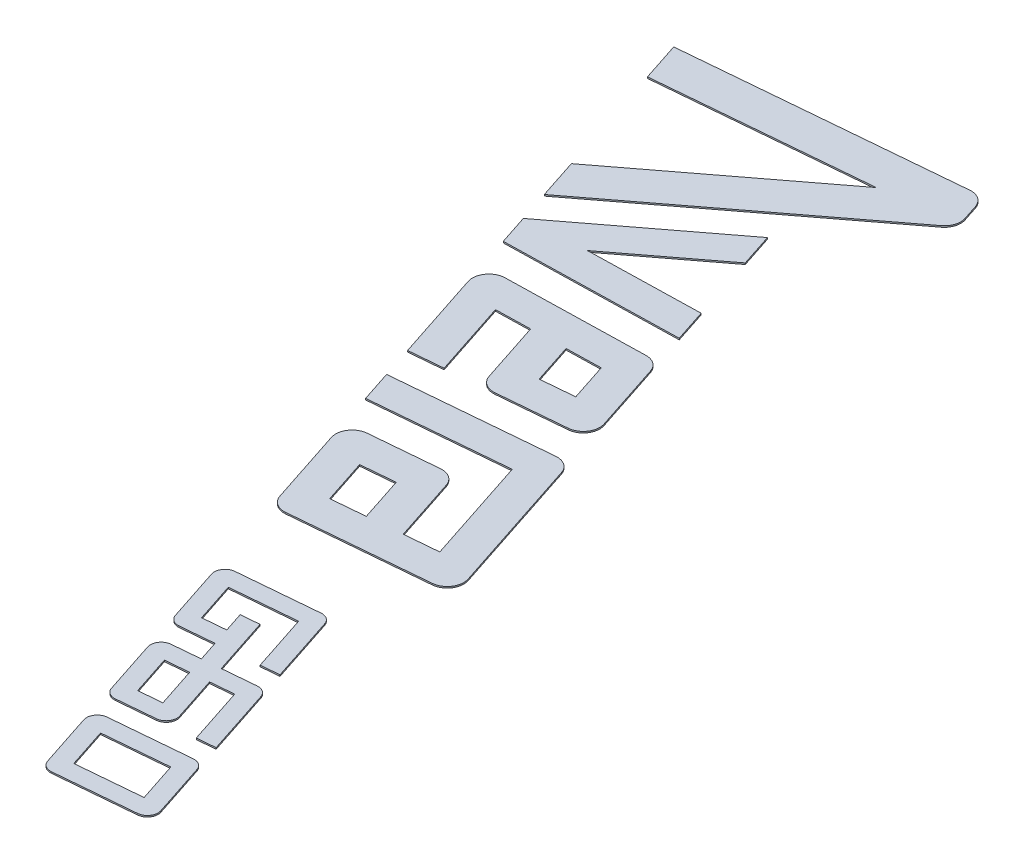
from build123d import *

# Parameters (mm, degrees)
BOSS_EXTRUDE1_DEPTH   = 0.1
BOSS_EXTRUDE1_2_DEPTH = 0.1
BOSS_EXTRUDE1_3_DEPTH = 0.1
BOSS_EXTRUDE1_4_DEPTH = 0.1
BOSS_EXTRUDE1_5_DEPTH = 0.1
BOSS_EXTRUDE1_6_DEPTH = 0.1


with BuildPart() as part:
    # Sketch1 → Boss-Extrude1 (new body)
    with BuildSketch(Plane(origin=(0, 0, 0), x_dir=(1, 0, 0), z_dir=(0, 1, 0))):
        Polygon((6.98019195, 11.199123603), (16.684431195, 18.582207132), (17.442796564, 16.269192757), (11.164089792, 11.492289037), (18.948427041, 11.677019802), (19.696913973, 9.394134661), (7.665603422, 9.108618613), align=None)
    extrude(amount=BOSS_EXTRUDE1_DEPTH)


with BuildPart() as body_2:
    # Sketch1 → Boss-Extrude1 2 (new body)
    with BuildSketch(Plane(origin=(0, 0, 0), x_dir=(1, 0, 0), z_dir=(0, 1, 0))):
        with BuildLine():
            Line((19.559550761, 7.188342037), (9.930020512, 6.959822841))
            ThreePointArc((9.930020512, 6.959822841), (9.018095469, 6.473763981), (8.864539605, 5.451863254))
            Line((8.864539605, 5.451863254), (10.932369195, -0.855016994))
            Line((10.932369195, -0.855016994), (13.284911092, -0.64784301))
            Line((13.284911092, -0.64784301), (11.532437194, 4.697202379))
            Line((11.532437194, 4.697202379), (13.080287744, 4.733934551))
            Line((13.080287744, 4.733934551), (13.934217495, 4.75419923))
            Line((13.934217495, 4.75419923), (14.200334782, 3.942541503))
            Line((14.200334782, 3.942541503), (15.353073683, 0.426687855))
            ThreePointArc((15.353073683, 0.426687855), (15.812662586, -0.175023319), (16.546720694, -0.360595378))
            Line((16.546720694, -0.360595378), (21.273754131, 0.05568556))
            ThreePointArc((21.273754131, 0.05568556), (22.132865535, 0.568076993), (22.265635064, 1.559535333))
            Line((22.265635064, 1.559535333), (20.679597799, 6.39694899))
            ThreePointArc((20.679597799, 6.39694899), (20.250451284, 6.977873828), (19.559550761, 7.188342037))
        make_face()
        Polygon((17.276171965, 2.012544247), (16.358406841, 4.811727872), (18.760187142, 4.868724724), (19.628713861, 2.219718231), align=None, mode=Mode.SUBTRACT)
    extrude(amount=BOSS_EXTRUDE1_2_DEPTH)


with BuildPart() as body_3:
    # Sketch1 → Boss-Extrude1 3 (new body)
    with BuildSketch(Plane(origin=(0, 0, 0), x_dir=(1, 0, 0), z_dir=(0, 1, 0))):
        with BuildLine():
            Line((6.263625411, 13.384651547), (5.340398005, 16.200495135))
            Line((5.340398005, 16.200495135), (17.459500781, 25.420831303))
            Line((17.459500781, 25.420831303), (2.742299504, 24.124695563))
            Line((2.742299504, 24.124695563), (1.846577535, 26.85664757))
            Line((1.846577535, 26.85664757), (20.884224807, 28.533282589))
            ThreePointArc((20.884224807, 28.533282589), (21.618286586, 28.347712831), (22.077878135, 27.745999912))
            Line((22.077878135, 27.745999912), (22.434184025, 26.659266946))
            ThreePointArc((22.434184025, 26.659266946), (22.439445548, 25.959164993), (22.037735709, 25.385754466))
            Line((22.037735709, 25.385754466), (6.263625411, 13.384651547))
        make_face()
    extrude(amount=BOSS_EXTRUDE1_3_DEPTH)


with BuildPart() as body_4:
    # Sketch1 → Boss-Extrude1 4 (new body)
    with BuildSketch(Plane(origin=(0, 0, 0), x_dir=(1, 0, 0), z_dir=(0, 1, 0))):
        with BuildLine():
            Line((11.648935734, -3.040544938), (12.365502273, -5.226072882))
            Line((12.365502273, -5.226072882), (21.797619503, -4.395443977))
            Line((21.797619503, -4.395443977), (24.270818832, -11.93870193))
            Line((24.270818832, -11.93870193), (21.918276935, -12.145875914))
            Line((21.918276935, -12.145875914), (20.446023451, -7.655502787))
            ThreePointArc((20.446023451, -7.655502787), (19.986434548, -7.053791613), (19.25237644, -6.868219553))
            Line((19.25237644, -6.868219553), (14.525343003, -7.284500491))
            ThreePointArc((14.525343003, -7.284500491), (13.666231599, -7.796891925), (13.53346207, -8.788350264))
            Line((13.53346207, -8.788350264), (15.29009486, -14.146080273))
            ThreePointArc((15.29009486, -14.146080273), (15.749683763, -14.747791447), (16.483741871, -14.933363506))
            Line((16.483741871, -14.933363506), (25.915859101, -14.1027346))
            ThreePointArc((25.915859101, -14.1027346), (26.774970506, -13.590343167), (26.907740034, -12.598884828))
            Line((26.907740034, -12.598884828), (23.717974166, -2.870098931))
            ThreePointArc((23.717974166, -2.870098931), (23.258385264, -2.268387757), (22.524327155, -2.082815697))
            Line((22.524327155, -2.082815697), (11.648935734, -3.040544938))
        make_face()
        Polygon((17.191243499, -12.562156852), (19.543785396, -12.354982868), (18.522925169, -9.241359178), (16.170383273, -9.448533162), align=None, mode=Mode.SUBTRACT)
    extrude(amount=BOSS_EXTRUDE1_4_DEPTH)


with BuildPart() as body_5:
    # Sketch1 → Boss-Extrude1 5 (new body)
    with BuildSketch(Plane(origin=(0, 0, 0), x_dir=(1, 0, 0), z_dir=(0, 1, 0))):
        with BuildLine():
            Line((18.272372732, -20.28827564), (23.817681611, -19.799934186))
            ThreePointArc((23.817681611, -19.799934186), (24.29641516, -19.920959442), (24.596147053, -20.313379773))
            Line((24.596147053, -20.313379773), (26.124210969, -24.973974717))
            Line((26.124210969, -24.973974717), (24.84565559, -25.086569273))
            Line((24.84565559, -25.086569273), (24.445779197, -23.866946274))
            Line((24.445779197, -23.866946274), (23.532003303, -21.079929797))
            Line((23.532003303, -21.079929797), (19.009538727, -21.478195606))
            Line((19.009538727, -21.478195606), (19.923314621, -24.265212083))
            Line((19.923314621, -24.265212083), (21.54526922, -24.122376457))
            Line((21.54526922, -24.122376457), (21.386383034, -23.637773589))
            Line((21.386383034, -23.637773589), (21.088381273, -22.728868218))
            Line((21.088381273, -22.728868218), (22.366936652, -22.616273662))
            Line((22.366936652, -22.616273662), (22.664938413, -23.525179033))
            Line((22.664938413, -23.525179033), (23.691026996, -26.654749211))
            Line((23.691026996, -26.654749211), (25.998536295, -26.451540973))
            ThreePointArc((25.998536295, -26.451540973), (26.477269844, -26.572566229), (26.777001737, -26.96498656))
            Line((26.777001737, -26.96498656), (28.305065653, -31.625581504))
            Line((28.305065653, -31.625581504), (27.026510275, -31.73817606))
            Line((27.026510275, -31.73817606), (26.626633881, -30.518553061))
            Line((26.626633881, -30.518553061), (25.712857987, -27.731536584))
            Line((25.712857987, -27.731536584), (24.090903389, -27.87437221))
            Line((24.090903389, -27.87437221), (25.110168769, -30.983131619))
            ThreePointArc((25.110168769, -30.983131619), (25.023579945, -31.629734883), (24.463289899, -31.963903209))
            Line((24.463289899, -31.963903209), (21.818490998, -32.196814481))
            ThreePointArc((21.818490998, -32.196814481), (21.339757449, -32.075789225), (21.040025556, -31.683368894))
            Line((21.040025556, -31.683368894), (19.806348547, -27.920654018))
            ThreePointArc((19.806348547, -27.920654018), (19.89293737, -27.274050753), (20.453227416, -26.939882427))
            Line((20.453227416, -26.939882427), (22.412471617, -26.767343767))
            Line((22.412471617, -26.767343767), (21.945145613, -25.341999456))
            Line((21.945145613, -25.341999456), (19.637636313, -25.545207694))
            ThreePointArc((19.637636313, -25.545207694), (19.158902764, -25.424182438), (18.859170871, -25.031762107))
            Line((18.859170871, -25.031762107), (17.625493863, -21.269047231))
            ThreePointArc((17.625493863, -21.269047231), (17.712082686, -20.622443966), (18.272372732, -20.28827564))
        make_face()
        Polygon((21.190393412, -28.129802393), (22.81234801, -27.986966767), (23.726123904, -30.773983243), (22.104169305, -30.91681887), align=None, mode=Mode.SUBTRACT)
    extrude(amount=BOSS_EXTRUDE1_5_DEPTH)


with BuildPart() as body_6:
    # Sketch1 → Boss-Extrude1 6 (new body)
    with BuildSketch(Plane(origin=(0, 0, 0), x_dir=(1, 0, 0), z_dir=(0, 1, 0))):
        with BuildLine():
            Line((22.634082101, -33.591489214), (28.179390979, -33.10314776))
            ThreePointArc((28.179390979, -33.10314776), (28.658124528, -33.224173016), (28.957856421, -33.616593347))
            Line((28.957856421, -33.616593347), (30.19153343, -37.379308223))
            ThreePointArc((30.19153343, -37.379308223), (30.104944607, -38.025911487), (29.544654561, -38.360079813))
            Line((29.544654561, -38.360079813), (23.999345682, -38.848421268))
            ThreePointArc((23.999345682, -38.848421268), (23.520612133, -38.727396012), (23.22088024, -38.334975681))
            Line((23.22088024, -38.334975681), (21.987203231, -34.572260805))
            ThreePointArc((21.987203231, -34.572260805), (22.073792054, -33.92565754), (22.634082101, -33.591489214))
        make_face()
        Polygon((23.371248096, -34.78140918), (27.893712672, -34.383143371), (28.807488565, -37.170159847), (24.28502399, -37.568425657), align=None, mode=Mode.SUBTRACT)
    extrude(amount=BOSS_EXTRUDE1_6_DEPTH)


solid = Compound([part.part, body_2.part, body_3.part, body_4.part, body_5.part, body_6.part])
